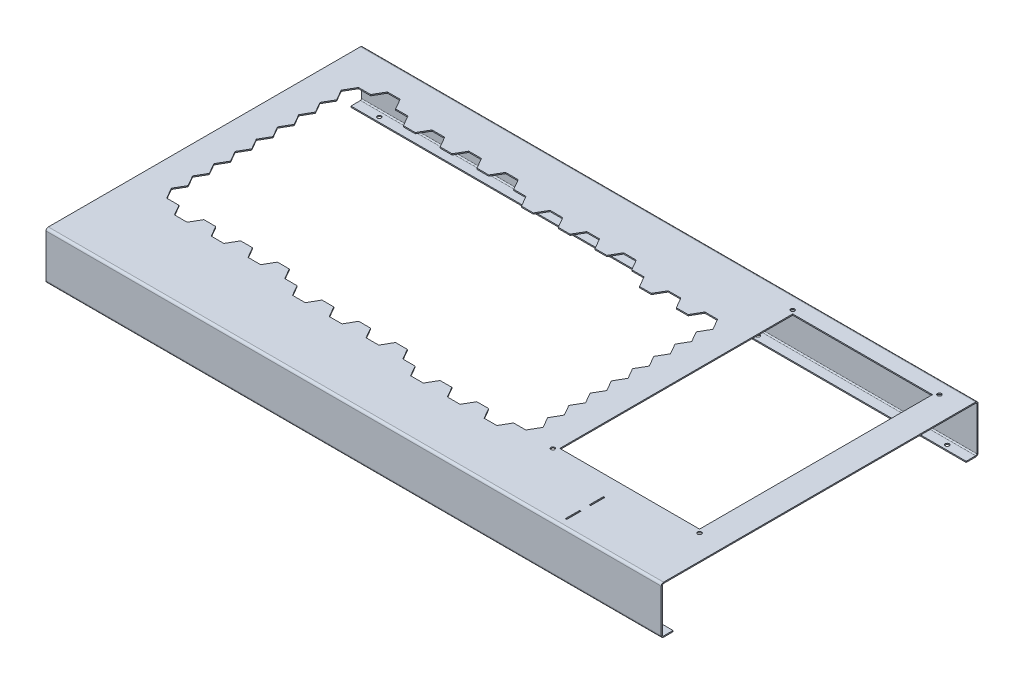
from build123d import *

# Parameters (mm, degrees)
SKETCH1_W                      = 660.4
SKETCH1_H                      = 340.0044
BASE_FLANGE1_DEPTH             = 1.2192
CUT_EXTRUDE1_DEPTH             = 372.395038273
SKETCH5_W                      = 150.0124
SKETCH5_H                      = 250.0122
CUT_EXTRUDE2_DEPTH             = 1.2192
EDGE_FLANGE1_STRIP_W           = 7.4168
EDGE_FLANGE1_STRIP_H           = 1.2192
EDGE_FLANGE1_STRIP_CUT_DEPTH   = 660.4
EDGE_FLANGE1_STRIP_2_W         = 7.4168
EDGE_FLANGE1_STRIP_2_H         = 1.2192
EDGE_FLANGE1_STRIP_CUT_2_DEPTH = 660.4
EDGE_FLANGE1_DEPTH             = 660.4
EDGE_FLANGE1_BEND_DEPTH        = 660.4
EDGE_FLANGE2_STRIP_W           = 7.4168
EDGE_FLANGE2_STRIP_H           = 1.2192
EDGE_FLANGE2_STRIP_CUT_DEPTH   = 660.4
EDGE_FLANGE2_STRIP_2_W         = 7.4168
EDGE_FLANGE2_STRIP_2_H         = 1.2192
EDGE_FLANGE2_STRIP_CUT_2_DEPTH = 660.4
EDGE_FLANGE2_DEPTH             = 660.4
EDGE_FLANGE2_BEND_DEPTH        = 660.4
SKETCH18_R                     = 2.1082
CUT_EXTRUDE3_DEPTH             = 1.2192
LPATTERN1_COUNT                = 4
LPATTERN1_PITCH                = 203.2
MIRROR1_COPY_1_SKETCH_R        = 2.1082
MIRROR1_COPY_1_DEPTH           = 1.2192
MIRROR1_COPY_2_SKETCH_R        = 2.1082
MIRROR1_COPY_2_DEPTH           = 1.2192
MIRROR1_COPY_3_SKETCH_R        = 2.1082
MIRROR1_COPY_3_DEPTH           = 1.2192
SKETCH19_R                     = 2.1082
CUT_EXTRUDE4_DEPTH             = 1.2192
SKETCH21_W                     = 1.524
SKETCH21_H                     = 15.24
CUT_EXTRUDE5_DEPTH             = 1.2192


# Sheet-metal steps are written as plain solids
with BuildPart() as part:
    # Sketch1 → Base-Flange1 (new body)
    with BuildSketch(Plane(origin=(0, 0, 0), x_dir=(1, 0, 0), z_dir=(0, 1, 0))):
        Rectangle(SKETCH1_W, SKETCH1_H)
    extrude(amount=-BASE_FLANGE1_DEPTH)

    # Sketch4 → Cut-Extrude1 (cut, through all)
    with BuildSketch(Plane(origin=(0, 0, 0), x_dir=(1, 0, 0), z_dir=(0, 1, 0))):
        Polygon((114.842126805, 105.8291), (121.646745743, 94.0435), (115.069436274, 82.6516), (121.646745743, 71.2597), (115.069436274, 59.8678), (121.646745743, 48.4759), (115.069436274, 37.084), (121.646745743, 25.6921), (115.069436274, 14.3002), (121.646745743, 2.9083), (115.069436274, -8.4836), (121.646745743, -19.8755), (115.069436274, -31.2674), (121.646745743, -42.6593), (115.069436274, -54.0512), (121.646745743, -65.4431), (115.069436274, -76.835), (121.646745743, -88.2269), (114.842126805, -100.0125), (101.687446274, -100.0125), (95.110136805, -111.4044), (81.500938938, -111.4044), (74.923629469, -100.0125), (62.223466274, -100.0125), (55.646156805, -111.4044), (42.036958938, -111.4044), (35.459649469, -100.0125), (22.759486274, -100.0125), (16.182176805, -111.4044), (2.572978938, -111.4044), (-4.004330531, -100.0125), (-17.159011062, -100.0125), (-23.736320531, -88.6206), (-36.436483726, -88.6206), (-43.013793195, -100.0125), (-56.622991062, -100.0125), (-63.200300531, -88.6206), (-75.900463726, -88.6206), (-82.477773195, -100.0125), (-96.086971062, -100.0125), (-102.664280531, -88.6206), (-115.364443726, -88.6206), (-121.941753195, -100.0125), (-135.550951062, -100.0125), (-142.128260531, -88.6206), (-155.282941062, -88.6206), (-161.860250531, -77.2287), (-174.560413726, -77.2287), (-181.137723195, -88.6206), (-194.746921062, -88.6206), (-201.324230531, -77.2287), (-214.024393726, -77.2287), (-220.601703195, -88.6206), (-234.210901062, -88.6206), (-240.788210531, -77.2287), (-253.488373726, -77.2287), (-260.065683195, -88.6206), (-273.674881062, -88.6206), (-280.252190531, -77.2287), (-293.397981062, -77.2287), (-300.2026, -65.4431), (-293.625290531, -54.0512), (-300.2026, -42.6593), (-293.625290531, -31.2674), (-300.2026, -19.8755), (-293.625290531, -8.4836), (-300.2026, 2.9083), (-293.625290531, 14.3002), (-300.2026, 25.6921), (-293.625290531, 37.084), (-300.2026, 48.4759), (-293.625290531, 59.8678), (-300.2026, 71.2597), (-293.625290531, 82.6516), (-300.2026, 94.0435), (-293.625290531, 105.4354), (-300.2026, 116.8273), (-293.397981062, 128.6129), (-280.252190531, 128.6129), (-273.674881062, 140.0048), (-260.065683195, 140.0048), (-253.488373726, 128.6129), (-240.333693195, 128.6129), (-233.756383726, 117.221), (-221.056220531, 117.221), (-214.478911062, 128.6129), (-200.869713195, 128.6129), (-194.292403726, 117.221), (-181.592240531, 117.221), (-175.014931062, 128.6129), (-161.405733195, 128.6129), (-154.828423726, 117.221), (-142.128260531, 117.221), (-135.550951062, 128.6129), (-121.941753195, 128.6129), (-115.364443726, 117.221), (-102.209763195, 117.221), (-95.632453726, 105.8291), (-82.932290531, 105.8291), (-76.354981062, 117.221), (-62.745783195, 117.221), (-56.168473726, 105.8291), (-43.468310531, 105.8291), (-36.891001062, 117.221), (-23.281803195, 117.221), (-16.704493726, 105.8291), (-4.004330531, 105.8291), (2.572978938, 117.221), (16.182176805, 117.221), (22.759486274, 105.8291), (35.914166805, 105.8291), (42.491476274, 94.4372), (55.191639469, 94.4372), (61.768948938, 105.8291), (75.378146805, 105.8291), (81.955456274, 94.4372), (94.655619469, 94.4372), (101.232928938, 105.8291), align=None)
    extrude(amount=-CUT_EXTRUDE1_DEPTH, mode=Mode.SUBTRACT)

    # Sketch5 → Cut-Extrude2 (cut)
    with BuildSketch(Plane(origin=(0, 0, 0), x_dir=(1, 0, 0), z_dir=(0, 1, 0))):
        with Locations((225.1964, 26.1239)):
            Rectangle(SKETCH5_W, SKETCH5_H)
    extrude(amount=-CUT_EXTRUDE2_DEPTH, mode=Mode.SUBTRACT)

    # Edge-Flange1 strip (across the edge) → Edge-Flange1 strip cut (cut)
    with BuildSketch(Plane(origin=(-330.2, -1.2192, -170.0022), x_dir=(0, 0, 1), z_dir=(1, 0, 0))):
        with Locations((-1.2192, -0.6096)):
            Rectangle(EDGE_FLANGE1_STRIP_W, EDGE_FLANGE1_STRIP_H)
    extrude(amount=EDGE_FLANGE1_STRIP_CUT_DEPTH, mode=Mode.SUBTRACT)

    # Edge-Flange1 strip 2 (across the edge) → Edge-Flange1 strip cut 2 (cut)
    with BuildSketch(Plane(origin=(330.2, -1.2192, 170.0022), x_dir=(0, 0, -1), z_dir=(-1, 0, 0))):
        with Locations((-1.2192, -0.6096)):
            Rectangle(EDGE_FLANGE1_STRIP_2_W, EDGE_FLANGE1_STRIP_2_H)
    extrude(amount=EDGE_FLANGE1_STRIP_CUT_2_DEPTH, mode=Mode.SUBTRACT)

    # Edge-Flange1 section (across the edge) → Edge-Flange1 (add)
    with BuildSketch(Plane(origin=(-330.2, -1.2192, -170.0022), x_dir=(0, 0, 1), z_dir=(1, 0, 0))):
        with BuildLine():
            Line((0, 1.27), (0, 48.7934))
            Line((0, 48.7934), (1.2192, 48.7934))
            Line((1.2192, 48.7934), (1.2192, 1.27))
            ThreePointArc((1.2192, 1.27), (1.591174388, 0.371974388), (2.4892, 0))
            Line((2.4892, 0), (2.4892, -1.2192))
            ThreePointArc((2.4892, -1.2192), (0.7290698, -0.4901302), (0, 1.27))
        make_face()
    extrude(amount=EDGE_FLANGE1_DEPTH)

    # Edge-Flange1 section 2 (across the edge) → Edge-Flange1 bend (add)
    with BuildSketch(Plane(origin=(330.2, -1.2192, 170.0022), x_dir=(0, 0, -1), z_dir=(-1, 0, 0))):
        with BuildLine():
            Line((0, 1.27), (0, 48.7934))
            Line((0, 48.7934), (1.2192, 48.7934))
            Line((1.2192, 48.7934), (1.2192, 1.27))
            ThreePointArc((1.2192, 1.27), (1.591174388, 0.371974388), (2.4892, 0))
            Line((2.4892, 0), (2.4892, -1.2192))
            ThreePointArc((2.4892, -1.2192), (0.7290698, -0.4901302), (0, 1.27))
        make_face()
    extrude(amount=EDGE_FLANGE1_BEND_DEPTH)

    # Edge-Flange2 strip (across the edge) → Edge-Flange2 strip cut (cut)
    with BuildSketch(Plane(origin=(-330.2, -50.0126, -168.783), x_dir=(0, 1, 0), z_dir=(1, 0, 0))):
        with Locations((-2.4384, -0.6096)):
            Rectangle(EDGE_FLANGE2_STRIP_W, EDGE_FLANGE2_STRIP_H)
    extrude(amount=EDGE_FLANGE2_STRIP_CUT_DEPTH, mode=Mode.SUBTRACT)

    # Edge-Flange2 strip 2 (across the edge) → Edge-Flange2 strip cut 2 (cut)
    with BuildSketch(Plane(origin=(330.2, -50.0126, 168.783), x_dir=(0, 1, 0), z_dir=(-1, 0, 0))):
        with Locations((-2.4384, -0.6096)):
            Rectangle(EDGE_FLANGE2_STRIP_2_W, EDGE_FLANGE2_STRIP_2_H)
    extrude(amount=EDGE_FLANGE2_STRIP_CUT_2_DEPTH, mode=Mode.SUBTRACT)

    # Edge-Flange2 section (across the edge) → Edge-Flange2 (add)
    with BuildSketch(Plane(origin=(-330.2, -50.0126, -168.783), x_dir=(0, 1, 0), z_dir=(1, 0, 0))):
        with BuildLine():
            Line((-1.2192, 1.27), (-1.2192, 11.4808))
            Line((-1.2192, 11.4808), (0, 11.4808))
            Line((0, 11.4808), (0, 1.27))
            ThreePointArc((0, 1.27), (0.371974388, 0.371974388), (1.27, 0))
            Line((1.27, 0), (1.27, -1.2192))
            ThreePointArc((1.27, -1.2192), (-0.4901302, -0.4901302), (-1.2192, 1.27))
        make_face()
    extrude(amount=EDGE_FLANGE2_DEPTH)

    # Edge-Flange2 section 2 (across the edge) → Edge-Flange2 bend (add)
    with BuildSketch(Plane(origin=(330.2, -50.0126, 168.783), x_dir=(0, 1, 0), z_dir=(-1, 0, 0))):
        with BuildLine():
            Line((-1.2192, 1.27), (-1.2192, 11.4808))
            Line((-1.2192, 11.4808), (0, 11.4808))
            Line((0, 11.4808), (0, 1.27))
            ThreePointArc((0, 1.27), (0.371974388, 0.371974388), (1.27, 0))
            Line((1.27, 0), (1.27, -1.2192))
            ThreePointArc((1.27, -1.2192), (-0.4901302, -0.4901302), (-1.2192, 1.27))
        make_face()
    extrude(amount=EDGE_FLANGE2_BEND_DEPTH)

    # Sketch18 → Cut-Extrude3 (cut)
    with BuildSketch(Plane.XZ.offset(51.2318)):
        with Locations(Location((304.8, 162.4076, 0), (0, 0, 270))):
            Circle(SKETCH18_R)
    cut_extrude3 = extrude(amount=-CUT_EXTRUDE3_DEPTH, mode=Mode.SUBTRACT)

    # LPattern1: Cut-Extrude3 ×4
    with Locations(*[(-i * LPATTERN1_PITCH, 0, 0) for i in range(1, LPATTERN1_COUNT)]):
        add(cut_extrude3, mode=Mode.SUBTRACT)

    # Mirror1: Cut-Extrude3 across plane
    add(cut_extrude3.mirror(Plane.XY), mode=Mode.SUBTRACT)

    # Mirror1 copy 1 sketch → Mirror1 copy 1 (cut)
    with BuildSketch(Plane(origin=(-203.2, -51.2318, 0), x_dir=(1, 0, 0), z_dir=(0, -1, 0))):
        with Locations((304.8, -162.4076)):
            Circle(MIRROR1_COPY_1_SKETCH_R)
    extrude(amount=-MIRROR1_COPY_1_DEPTH, mode=Mode.SUBTRACT)

    # Mirror1 copy 2 sketch → Mirror1 copy 2 (cut)
    with BuildSketch(Plane(origin=(-406.4, -51.2318, 0), x_dir=(1, 0, 0), z_dir=(0, -1, 0))):
        with Locations((304.8, -162.4076)):
            Circle(MIRROR1_COPY_2_SKETCH_R)
    extrude(amount=-MIRROR1_COPY_2_DEPTH, mode=Mode.SUBTRACT)

    # Mirror1 copy 3 sketch → Mirror1 copy 3 (cut)
    with BuildSketch(Plane(origin=(-609.6, -51.2318, 0), x_dir=(1, 0, 0), z_dir=(0, -1, 0))):
        with Locations((304.8, -162.4076)):
            Circle(MIRROR1_COPY_3_SKETCH_R)
    extrude(amount=-MIRROR1_COPY_3_DEPTH, mode=Mode.SUBTRACT)

    # Sketch19 → Cut-Extrude4 (cut)
    with BuildSketch(Plane(origin=(0, 0, 0), x_dir=(1, 0, 0), z_dir=(0, 1, 0))):
        with Locations(Location((146.454413454, 154.865786546, 0), (0, 0, 270))):
            Circle(SKETCH19_R)
        with Locations(Location((303.938386546, 154.865786546, 0), (0, 0, 90))):
            Circle(SKETCH19_R)
        with Locations(Location((303.938386546, -102.617986546, 0), (0, 0, 270))):
            Circle(SKETCH19_R)
        with Locations(Location((146.454413454, -102.617986546, 0), (0, 0, 90))):
            Circle(SKETCH19_R)
    extrude(amount=-CUT_EXTRUDE4_DEPTH, mode=Mode.SUBTRACT)

    # Sketch21 → Cut-Extrude5 (cut)
    with BuildSketch(Plane(origin=(0, 0, 0), x_dir=(1, 0, 0), z_dir=(0, 1, 0))):
        with Locations((219.202, -127.9144)):
            Rectangle(SKETCH21_W, SKETCH21_H)
        with Locations((219.202, -153.4922)):
            Rectangle(SKETCH21_W, SKETCH21_H)
    extrude(amount=-CUT_EXTRUDE5_DEPTH, mode=Mode.SUBTRACT)


solid = part.part
